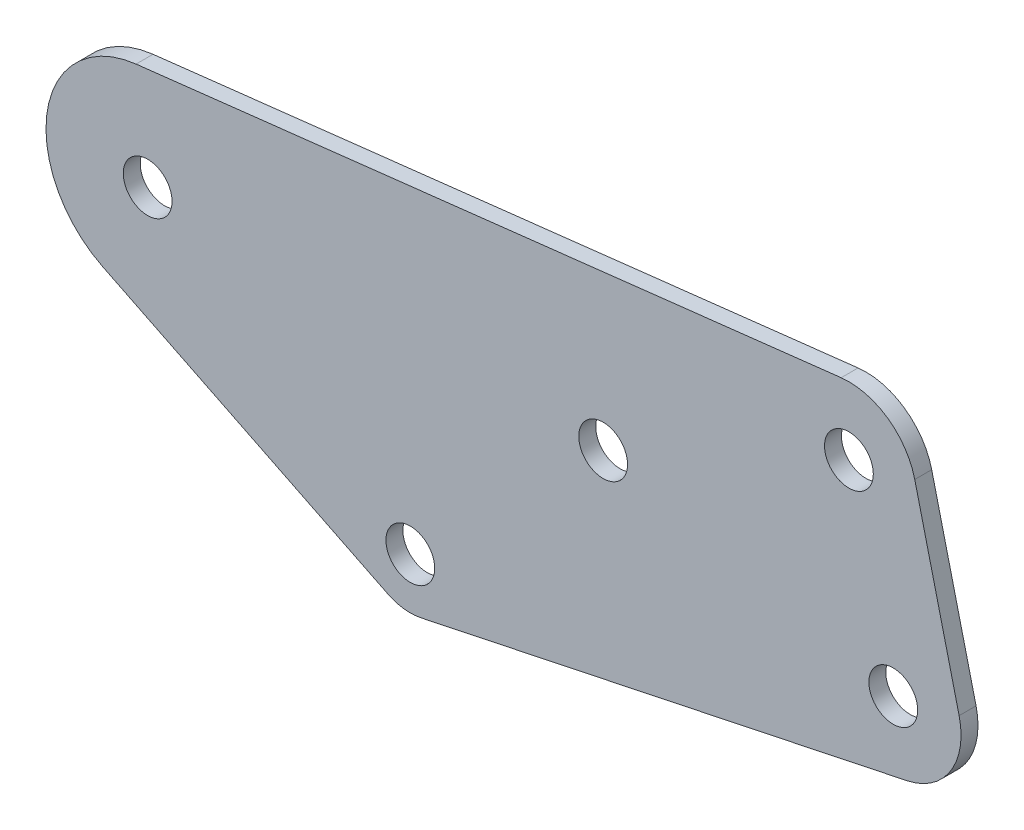
from build123d import *

# Parameters (mm, degrees)
SKETCH1_R           = 2.286
BOSS_EXTRUDE1_DEPTH = 1.5875


with BuildPart() as part:
    # Sketch1 → Boss-Extrude1 (new body)
    with BuildSketch(Plane.XY):
        with BuildLine():
            Line((64.968259902, 17.043099966), (-1.085936833, 9.462894176))
            ThreePointArc((-1.085936833, 9.462894176), (-9.384101761, 1.632255842), (-4.21740813, -8.540438728))
            Line((-4.21740813, -8.540438728), (22.497545935, -21.732719364))
            ThreePointArc((22.497545935, -21.732719364), (24.007942134, -22.187268137), (25.583966401, -22.123559632))
            Line((25.583966401, -22.123559632), (71.153621868, -12.564746176))
            ThreePointArc((71.153621868, -12.564746176), (75.221101534, -9.737295131), (76.019915726, -4.848454151))
            Line((76.019915726, -4.848454151), (71.862133516, 12.236049697))
            ThreePointArc((71.862133516, 12.236049697), (69.32423476, 15.943241962), (64.968259902, 17.043099966))
        make_face()
        Circle(SKETCH1_R, mode=Mode.SUBTRACT)
        with Locations((42.672, 0)):
            Circle(SKETCH1_R, mode=Mode.SUBTRACT)
        with Locations((65.692217791, 10.734503848)):
            Circle(SKETCH1_R, mode=Mode.SUBTRACT)
        with Locations((24.60625, -17.4625)):
            Circle(SKETCH1_R, mode=Mode.SUBTRACT)
        with Locations((69.85, -6.35)):
            Circle(SKETCH1_R, mode=Mode.SUBTRACT)
    extrude(amount=BOSS_EXTRUDE1_DEPTH)


solid = part.part
